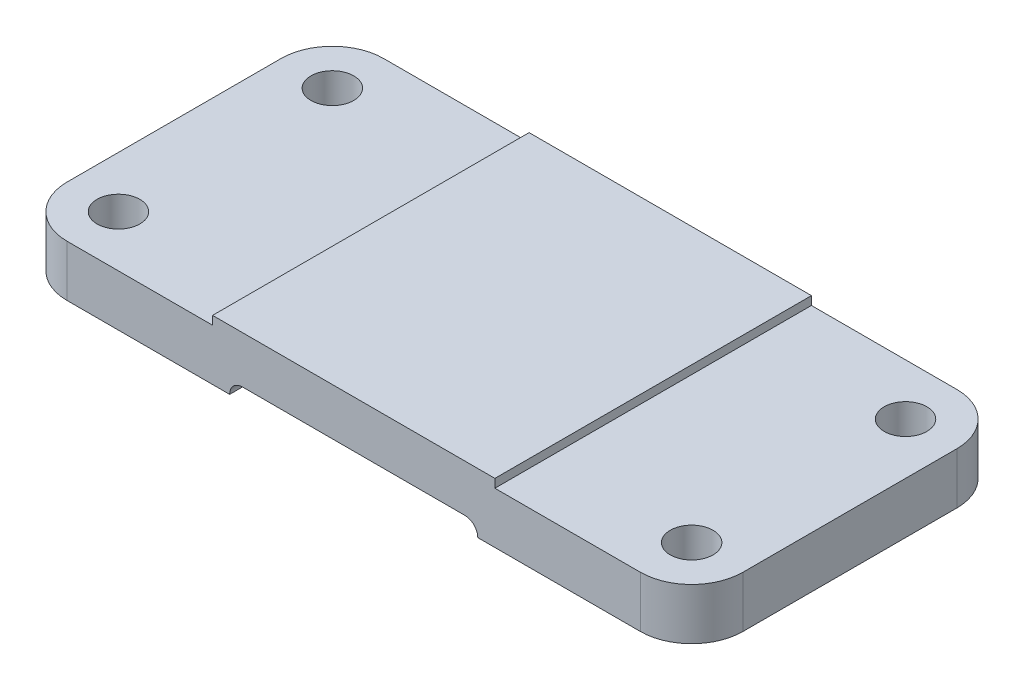
from build123d import *

# Parameters (mm, degrees)
BOSS_EXTRUDE1_DEPTH = 12
BOSS_EXTRUDE2_DEPTH = 2
CUT_EXTRUDE1_DEPTH  = 3
FILLET1_R           = 3
FILLET2_R           = 3
HOLE2_D             = 10
HOLE3_D             = 10
HOLE4_D             = 10
HOLE5_D             = 10


with BuildPart() as part:
    # Sketch1 → Boss-Extrude1 (new body)
    with BuildSketch(Plane(origin=(0, 0, 0), x_dir=(1, 0, 0), z_dir=(0, 1, 0))):
        with BuildLine():
            Line((-76.865222767, 28.026373193), (57.134777233, 28.026373193))
            ThreePointArc((57.134777233, 28.026373193), (65.620058607, 24.511654567), (69.134777233, 16.026373193))
            Line((69.134777233, 16.026373193), (69.134777233, -33.973626807))
            ThreePointArc((69.134777233, -33.973626807), (65.620058607, -42.458908182), (57.134777233, -45.973626807))
            Line((57.134777233, -45.973626807), (-76.865222767, -45.973626807))
            ThreePointArc((-76.865222767, -45.973626807), (-85.350504141, -42.458908182), (-88.865222767, -33.973626807))
            Line((-88.865222767, -33.973626807), (-88.865222767, 16.026373193))
            ThreePointArc((-88.865222767, 16.026373193), (-85.350504141, 24.511654567), (-76.865222767, 28.026373193))
        make_face()
    extrude(amount=BOSS_EXTRUDE1_DEPTH)

    # Sketch2 → Boss-Extrude2 (add)
    with BuildSketch(Plane(origin=(0, 12, 0), x_dir=(-1, 0, 0), z_dir=(0, 1, 0))):
        Polygon((9.865222767, -28.026373193), (42.865222767, -28.026373193), (42.865222767, 45.973626807), (-23.134777233, 45.973626807), (-23.134777233, -28.026373193), align=None)
    extrude(amount=BOSS_EXTRUDE2_DEPTH)

    # Sketch3 → Cut-Extrude1 (cut)
    with BuildSketch(Plane.XZ):
        Polygon((-9.865222767, 45.973626807), (19.134777233, 45.973626807), (19.134777233, -28.026373193), (-38.865222767, -28.026373193), (-38.865222767, 45.973626807), align=None)
    extrude(amount=-CUT_EXTRUDE1_DEPTH, mode=Mode.SUBTRACT)

    # Fillet1
    fillet1_edges = [part.edges().sort_by_distance(p)[0] for p in [
        (-38.865222767, 3, 8.973626807),
    ]]
    fillet(fillet1_edges, radius=FILLET1_R - 0.0001)  # a hair under: the kernel refuses the full size

    # Fillet2
    fillet2_edges = [part.edges().sort_by_distance(p)[0] for p in [
        (19.134777233, 3, 8.973626807),
    ]]
    fillet(fillet2_edges, radius=FILLET2_R - 0.0001)  # a hair under: the kernel refuses the full size

    # Hole2 (through all)
    with Locations(Plane(origin=(0, 12, 0), x_dir=(-1, 0, 0), z_dir=(0, 1, 0))):
        with Locations((76.865222767, -16.026373193)):
            Hole(HOLE2_D / 2)

    # Hole3 (through all)
    with Locations(Plane(origin=(0, 12, 0), x_dir=(-1, 0, 0), z_dir=(0, 1, 0))):
        with Locations((76.865222767, 33.973626807)):
            Hole(HOLE3_D / 2)

    # Hole4 (through all)
    with Locations(Plane(origin=(0, 12, 0), x_dir=(-1, 0, 0), z_dir=(0, 1, 0))):
        with Locations((-57.134777233, 33.973626807)):
            Hole(HOLE4_D / 2)

    # Hole5 (through all)
    with Locations(Plane(origin=(0, 12, 0), x_dir=(-1, 0, 0), z_dir=(0, 1, 0))):
        with Locations((-57.134777233, -16.026373193)):
            Hole(HOLE5_D / 2)


solid = part.part
